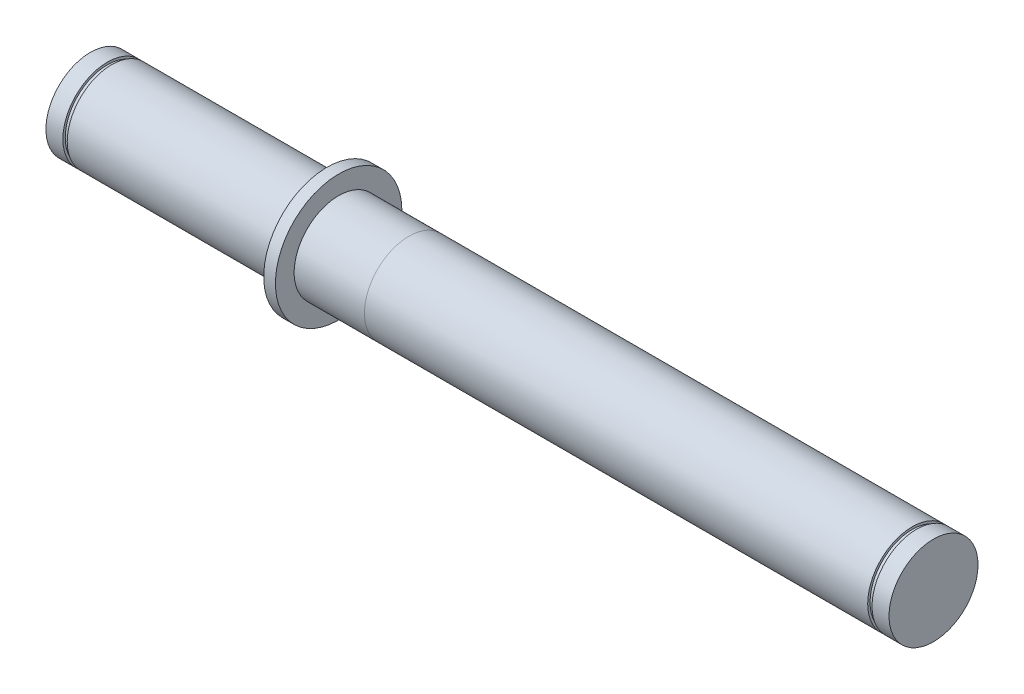
from build123d import *

# Parameters (mm, degrees)
SKIZZE19_W = 1.85
SKIZZE19_H = 1
SKIZZE20_W = 1.85
SKIZZE20_H = 1


with BuildPart() as part:
    # Skizze1 → Rotation1 (revolve)
    with BuildSketch(Plane.XY):
        Polygon((180, 19), (180, 0), (-180, 0), (-180, 19), (-79, 19), (-79, 27), (-74, 27), (-74, 19.001), (-44, 19.001), (-44, 19), align=None)
    revolve(axis=Axis((180, 0, 0), (-1, 0, 0)))

    # Skizze19 → Schnitt-Rotation1 (revolve, cut)
    with BuildSketch(Plane.XY):
        with Locations((171.825, 18.5)):
            Rectangle(SKIZZE19_W, SKIZZE19_H)
    revolve(axis=Axis((-88.99, 0, 0), (1, 0, 0)), mode=Mode.SUBTRACT)

    # Skizze20 → Schnitt-Rotation2 (revolve, cut)
    with BuildSketch(Plane.XY):
        with Locations((-171.825, 18.5)):
            Rectangle(SKIZZE20_W, SKIZZE20_H)
    revolve(axis=Axis((-88.99, 0, 0), (1, 0, 0)), mode=Mode.SUBTRACT)


solid = part.part
